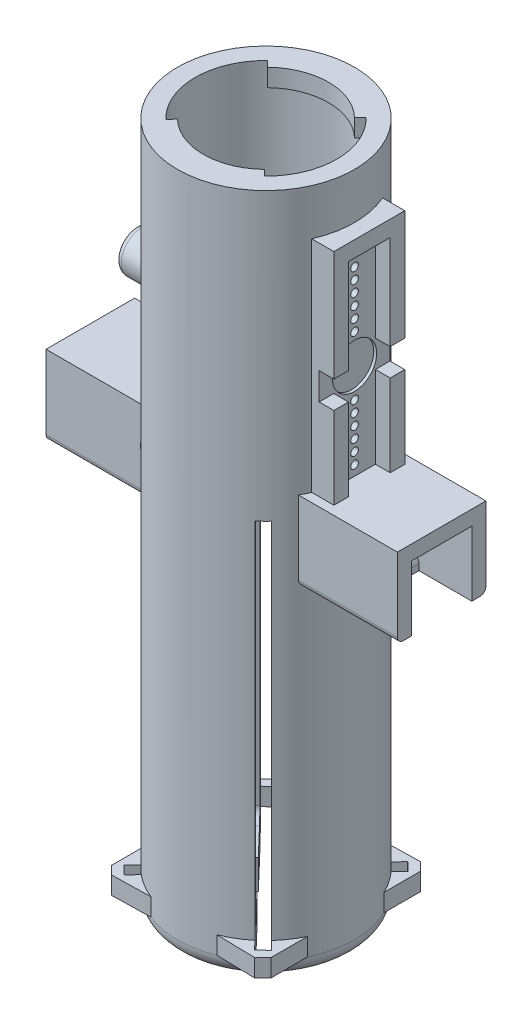
from build123d import *

# Parameters (mm, degrees)
BOSS_EXTRUDE1_START      = -7.5
SKETCH1_R                = 15
BOSS_EXTRUDE1_DEPTH      = 116
CUT_EXTRUDE1_START       = -5
SKETCH2_R                = 12
CUT_EXTRUDE1_DEPTH       = 111
CUT_EXTRUDE2_DEPTH       = 67.5
CUT_EXTRUDE4_START       = -15.000000102
CUT_EXTRUDE4_OUTLINE_R   = 2.85
CUT_EXTRUDE4_DEPTH       = 30.000000204
BOSS_EXTRUDE2_DEPTH      = 16.759618943
SKETCH6_W                = 18.225569428
SKETCH6_H                = 2.4
BOSS_EXTRUDE3_DEPTH      = 11
SKETCH8_W                = 6.702306922
SKETCH8_H                = 2.026544108
BOSS_EXTRUDE4_DEPTH      = 10.2
SKETCH9_W                = 0.702306922
SKETCH9_H                = 8.973455892
BOSS_EXTRUDE5_DEPTH      = 2
MIRROR6_COPY_1_SKETCH_W  = 0.702306922
MIRROR6_COPY_1_SKETCH_H  = 8.973455892
MIRROR6_COPY_1_DEPTH     = 2
BOSS_EXTRUDE13_DEPTH     = 2.628156968
BOSS_EXTRUDE15_START     = -3
BOSS_EXTRUDE15_DEPTH     = 3
SKETCH21_W               = 2.475
SKETCH21_H               = 13.9
BOSS_EXTRUDE16_DEPTH     = 2.5
SKETCH22_R               = 3.75
CUT_EXTRUDE6_DEPTH       = 0.5
BOSS_EXTRUDE17_START     = -22
BOSS_EXTRUDE17_OUTLINE_R = 3.5
BOSS_EXTRUDE17_DEPTH     = 7.414047957
FILLET1_R                = 1
CUT_EXTRUDE7_REACH       = 120.321
CUT_EXTRUDE7_END_RADIUS  = 12
SKETCH23_R               = 0.65
FILLET2_R                = 1
BOSS_EXTRUDE18_START     = -3
BOSS_EXTRUDE18_DEPTH     = 3
FILLET3_R                = 1.75
FILLET5_R                = 3


# Read off the part's stored shape, not the designer's step: Cut-Extrude4, Boss-Extrude17
with BuildPart() as part:
    # Sketch1 → Boss-Extrude1 (new body)
    with BuildSketch(Plane(origin=(0, 0, 0), x_dir=(1, 0, 0), z_dir=(0, 1, 0)).offset(BOSS_EXTRUDE1_START)):
        with Locations(Location((0, 0, 0), (0, 0, 270))):
            Circle(SKETCH1_R)
    extrude(amount=BOSS_EXTRUDE1_DEPTH)

    # Sketch2 → Cut-Extrude1 (cut)
    with BuildSketch(Plane(origin=(0, -7.5, 0), x_dir=(-1, 0, 0), z_dir=(0, -1, 0)).offset(CUT_EXTRUDE1_START)):
        with Locations(Location((0, 0, 0), (0, 0, 90))):
            Circle(SKETCH2_R)
    extrude(amount=-CUT_EXTRUDE1_DEPTH, mode=Mode.SUBTRACT)

    # Sketch3 → Cut-Extrude2 (cut)
    with BuildSketch(Plane.XZ.offset(7.5)):
        with BuildLine():
            Line((1.812764776, -3.339743084), (9.627255771, -11.502866874))
            ThreePointArc((9.627255771, -11.502866874), (10.372695837, -10.835459431), (11.071983695, -10.119840763))
            Line((11.071983695, -10.119840763), (3.2574927, -1.956716973))
            ThreePointArc((3.2574927, -1.956716973), (2.627749612, -2.744983056), (1.812764776, -3.339743084))
        make_face()
        with BuildLine():
            ThreePointArc((-9.627255771, 11.502866874), (-10.372695837, 10.835459431), (-11.071983695, 10.119840763))
            Line((-11.071983695, 10.119840763), (-3.2574927, 1.956716973))
            ThreePointArc((-3.2574927, 1.956716973), (-2.627749612, 2.744983056), (-1.812764776, 3.339743084))
            Line((-1.812764776, 3.339743084), (-9.627255771, 11.502866874))
        make_face()
        with BuildLine():
            ThreePointArc((-11.071983695, -10.119840763), (-10.372695837, -10.835459431), (-9.627255771, -11.502866874))
            Line((-9.627255771, -11.502866874), (-1.812764776, -3.339743084))
            ThreePointArc((-1.812764776, -3.339743084), (-2.627749612, -2.744983056), (-3.2574927, -1.956716973))
            Line((-3.2574927, -1.956716973), (-11.071983695, -10.119840763))
        make_face()
        with BuildLine():
            ThreePointArc((1.812764776, 3.339743084), (2.627749612, 2.744983056), (3.2574927, 1.956716973))
            Line((3.2574927, 1.956716973), (11.071983695, 10.119840763))
            ThreePointArc((11.071983695, 10.119840763), (10.372695837, 10.835459431), (9.627255771, 11.502866874))
            Line((9.627255771, 11.502866874), (1.812764776, 3.339743084))
        make_face()
        with BuildLine():
            Line((0, 1.446104295), (1.3843437, 0))
            Line((1.3843437, 0), (3.2574927, 1.956716973))
            ThreePointArc((3.2574927, 1.956716973), (2.627749612, 2.744983056), (1.812764776, 3.339743084))
            Line((1.812764776, 3.339743084), (0, 1.446104295))
        make_face()
        with BuildLine():
            ThreePointArc((-3.2574927, -1.956716973), (-2.627749612, -2.744983056), (-1.812764776, -3.339743084))
            Line((-1.812764776, -3.339743084), (0, -1.446104295))
            Line((0, -1.446104295), (-1.3843437, 0))
            Line((-1.3843437, 0), (-3.2574927, -1.956716973))
        make_face()
        with BuildLine():
            Line((-3.2574927, 1.956716973), (-1.3843437, 0))
            Line((-1.3843437, 0), (0, 1.446104295))
            Line((0, 1.446104295), (-1.812764776, 3.339743084))
            ThreePointArc((-1.812764776, 3.339743084), (-2.627749612, 2.744983056), (-3.2574927, 1.956716973))
        make_face()
        with BuildLine():
            ThreePointArc((-3.2574927, 1.956716973), (-3.8, 0), (-3.2574927, -1.956716973))
            Line((-3.2574927, -1.956716973), (-1.3843437, 0))
            Line((-1.3843437, 0), (-3.2574927, 1.956716973))
        make_face()
        Polygon((-1.3843437, 0), (0, -1.446104295), (1.3843437, 0), (0, 1.446104295), align=None)
        with BuildLine():
            Line((-1.812764776, 3.339743084), (0, 1.446104295))
            Line((0, 1.446104295), (1.812764776, 3.339743084))
            ThreePointArc((1.812764776, 3.339743084), (0, 3.8), (-1.812764776, 3.339743084))
        make_face()
        with BuildLine():
            Line((3.2574927, 1.956716973), (1.3843437, 0))
            Line((1.3843437, 0), (3.2574927, -1.956716973))
            ThreePointArc((3.2574927, -1.956716973), (3.661862385, -1.015265419), (3.8, 0))
            ThreePointArc((3.8, 0), (3.661862385, 1.015265419), (3.2574927, 1.956716973))
        make_face()
        with BuildLine():
            Line((0, -1.446104295), (-1.812764776, -3.339743084))
            ThreePointArc((-1.812764776, -3.339743084), (0, -3.8), (1.812764776, -3.339743084))
            Line((1.812764776, -3.339743084), (0, -1.446104295))
        make_face()
        with BuildLine():
            Line((1.3843437, 0), (0, -1.446104295))
            Line((0, -1.446104295), (1.812764776, -3.339743084))
            ThreePointArc((1.812764776, -3.339743084), (2.627749612, -2.744983056), (3.2574927, -1.956716973))
            Line((3.2574927, -1.956716973), (1.3843437, 0))
        make_face()
    extrude(amount=-CUT_EXTRUDE2_DEPTH, mode=Mode.SUBTRACT)

    # Cut-Extrude4 outline → Cut-Extrude4 (cut)
    with BuildSketch(Plane.YZ.offset(CUT_EXTRUDE4_START)):
        with Locations((57.25, 0)):
            Circle(CUT_EXTRUDE4_OUTLINE_R)
    extrude(amount=CUT_EXTRUDE4_DEPTH, mode=Mode.SUBTRACT)

    # 3DSketch3 → Boss-Extrude2 (add)
    with BuildSketch(Plane(origin=(29.75, 61, 7.5), x_dir=(0, 0.16439898730535613, -0.986393923832144), z_dir=(-1, 0, 0))):
        Polygon((0, 0), (14.795908857, 2.46598481), (15.206906326, 0), (0.410997468, -2.46598481), align=None)
    boss_extrude2 = extrude(amount=BOSS_EXTRUDE2_DEPTH)

    # Sketch6 → Boss-Extrude3 (add)
    with BuildSketch(Plane.XZ.offset(-61)):
        with Locations((20.637215286, -6.3)):
            Rectangle(SKETCH6_W, SKETCH6_H)
        with Locations((20.637215286, 6.3)):
            Rectangle(SKETCH6_W, SKETCH6_H)
    boss_extrude3 = extrude(amount=BOSS_EXTRUDE3_DEPTH)

    # Sketch8 → Boss-Extrude4 (add)
    with BuildSketch(Plane.XY.offset(-5.1)):
        with Locations((17.457534996, 51.013272054)):
            Rectangle(SKETCH8_W, SKETCH8_H)
    boss_extrude4 = extrude(amount=BOSS_EXTRUDE4_DEPTH)

    # Sketch9 → Boss-Extrude5 (add)
    with BuildSketch(Plane.XY.offset(-5.1)):
        with Locations((14.457534996, 56.513272054)):
            Rectangle(SKETCH9_W, SKETCH9_H)
    boss_extrude5 = extrude(amount=BOSS_EXTRUDE5_DEPTH)

    # Mirror3: Boss-Extrude5 across plane
    add(boss_extrude5.mirror(Plane.XY))

    # Mirror6: Boss-Extrude2, Boss-Extrude3, Boss-Extrude4, Boss-Extrude5 across plane
    add(boss_extrude2.mirror(Plane(origin=(0, 0, 0), x_dir=(0, 0, 1), z_dir=(1, 0, 0))))
    add(boss_extrude3.mirror(Plane(origin=(0, 0, 0), x_dir=(0, 0, 1), z_dir=(1, 0, 0))))
    add(boss_extrude4.mirror(Plane(origin=(0, 0, 0), x_dir=(0, 0, 1), z_dir=(1, 0, 0))))
    add(boss_extrude5.mirror(Plane(origin=(0, 0, 0), x_dir=(0, 0, 1), z_dir=(1, 0, 0))))

    # Mirror6 copy 1 sketch → Mirror6 copy 1 (add)
    with BuildSketch(Plane(origin=(0, 0, 5.1), x_dir=(-1, 0, 0), z_dir=(0, 0, -1))):
        with Locations((14.457534996, 56.513272054)):
            Rectangle(MIRROR6_COPY_1_SKETCH_W, MIRROR6_COPY_1_SKETCH_H)
    extrude(amount=MIRROR6_COPY_1_DEPTH)

    # 3DSketch4 → Boss-Extrude13 (add)
    with BuildSketch(Plane(origin=(15, 63.5, 6), x_dir=(0, 0.9517086177605509, -0.3070027799227583), z_dir=(-1, 0, 0))):
        Polygon((0, 0), (3.684033359, 11.420503413), (39.08759394, 0), (35.403560581, -11.420503413), align=None)
    extrude(amount=BOSS_EXTRUDE13_DEPTH)

    # Sketch20 → Boss-Extrude15 (add)
    with BuildSketch(Plane(origin=(0, 108.5, 0), x_dir=(1, 0, 0), z_dir=(0, 1, 0)).offset(BOSS_EXTRUDE15_START)):
        with BuildLine():
            Line((8.335900446, -8.632077604), (7.363378727, -7.625001884))
            ThreePointArc((7.363378727, -7.625001884), (0, -10.6), (-7.363378727, -7.625001884))
            Line((-7.363378727, -7.625001884), (-8.335900446, -8.632077604))
            ThreePointArc((-8.335900446, -8.632077604), (0, -12), (8.335900446, -8.632077604))
        make_face()
        with BuildLine():
            Line((-8.335900446, 8.632077604), (-7.363378727, 7.625001884))
            ThreePointArc((-7.363378727, 7.625001884), (0, 10.6), (7.363378727, 7.625001884))
            Line((7.363378727, 7.625001884), (8.335900446, 8.632077604))
            ThreePointArc((8.335900446, 8.632077604), (0, 12), (-8.335900446, 8.632077604))
        make_face()
    extrude(amount=BOSS_EXTRUDE15_DEPTH)

    # Sketch21 → Boss-Extrude16 (add)
    with BuildSketch(Plane(origin=(15, 0, 0), x_dir=(0, 0, -1), z_dir=(1, 0, 0))):
        with Locations((-4.7625, 70.45)):
            Rectangle(SKETCH21_W, SKETCH21_H)
        with Locations((4.7625, 70.45)):
            Rectangle(SKETCH21_W, SKETCH21_H)
        Polygon((-6, 100.7), (-6, 82), (-3.525, 82), (-3.525, 98), (3.525, 98), (3.525, 82), (6, 82), (6, 100.7), align=None)
    extrude(amount=BOSS_EXTRUDE16_DEPTH)

    # Sketch22 → Cut-Extrude6 (cut)
    with BuildSketch(Plane(origin=(15, 0, 0), x_dir=(0, 0, -1), z_dir=(1, 0, 0))):
        with Locations((0, 79.7)):
            Circle(SKETCH22_R)
    extrude(amount=-CUT_EXTRUDE6_DEPTH, mode=Mode.SUBTRACT)

    # Boss-Extrude17 outline → Boss-Extrude17 (add)
    with BuildSketch(Plane.YZ.offset(BOSS_EXTRUDE17_START)):
        with Locations((78.5, 0)):
            Circle(BOSS_EXTRUDE17_OUTLINE_R)
    extrude(amount=BOSS_EXTRUDE17_DEPTH)

    # Fillet1
    fillet1_edges = [part.edges().sort_by_distance(p)[0] for p in [
        (-22, 75, 0),
    ]]
    fillet(fillet1_edges, radius=FILLET1_R)

    # Cut-Extrude7: up to this cylinder (the profile starts outside it)
    cut_extrude7_end = Plane(origin=(0, 79.7, 0), z_dir=(0, -1, 0)) * Cylinder(CUT_EXTRUDE7_END_RADIUS, 294.642, mode=Mode.PRIVATE)
    # Sketch23 → Cut-Extrude7 (cut, up to the surface)
    with BuildSketch(Plane(origin=(15, 0, 0), x_dir=(0, 0, -1), z_dir=(1, 0, 0)), mode=Mode.PRIVATE) as cut_extrude7_sk1:
        with Locations((0, 94.2)):
            Circle(SKETCH23_R)
    cut_extrude7_tool1 = extrude(cut_extrude7_sk1.sketch, amount=-CUT_EXTRUDE7_REACH, mode=Mode.PRIVATE) - cut_extrude7_end
    add(cut_extrude7_tool1.solids().sort_by_distance((15, 94.2, 0))[0], mode=Mode.SUBTRACT)
    # Sketch23 → Cut-Extrude7 (cut, up to the surface)
    with BuildSketch(Plane(origin=(15, 0, 0), x_dir=(0, 0, -1), z_dir=(1, 0, 0)), mode=Mode.PRIVATE) as cut_extrude7_sk2:
        with Locations((0, 92.3)):
            Circle(SKETCH23_R)
    cut_extrude7_tool2 = extrude(cut_extrude7_sk2.sketch, amount=-CUT_EXTRUDE7_REACH, mode=Mode.PRIVATE) - cut_extrude7_end
    add(cut_extrude7_tool2.solids().sort_by_distance((15, 92.3, 0))[0], mode=Mode.SUBTRACT)
    # Sketch23 → Cut-Extrude7 (cut, up to the surface)
    with BuildSketch(Plane(origin=(15, 0, 0), x_dir=(0, 0, -1), z_dir=(1, 0, 0)), mode=Mode.PRIVATE) as cut_extrude7_sk3:
        with Locations((0, 90.4)):
            Circle(SKETCH23_R)
    cut_extrude7_tool3 = extrude(cut_extrude7_sk3.sketch, amount=-CUT_EXTRUDE7_REACH, mode=Mode.PRIVATE) - cut_extrude7_end
    add(cut_extrude7_tool3.solids().sort_by_distance((15, 90.4, 0))[0], mode=Mode.SUBTRACT)
    # Sketch23 → Cut-Extrude7 (cut, up to the surface)
    with BuildSketch(Plane(origin=(15, 0, 0), x_dir=(0, 0, -1), z_dir=(1, 0, 0)), mode=Mode.PRIVATE) as cut_extrude7_sk4:
        with Locations((0, 88.5)):
            Circle(SKETCH23_R)
    cut_extrude7_tool4 = extrude(cut_extrude7_sk4.sketch, amount=-CUT_EXTRUDE7_REACH, mode=Mode.PRIVATE) - cut_extrude7_end
    add(cut_extrude7_tool4.solids().sort_by_distance((15, 88.5, 0))[0], mode=Mode.SUBTRACT)
    # Sketch23 → Cut-Extrude7 (cut, up to the surface)
    with BuildSketch(Plane(origin=(15, 0, 0), x_dir=(0, 0, -1), z_dir=(1, 0, 0)), mode=Mode.PRIVATE) as cut_extrude7_sk5:
        with Locations((0, 86.6)):
            Circle(SKETCH23_R)
    cut_extrude7_tool5 = extrude(cut_extrude7_sk5.sketch, amount=-CUT_EXTRUDE7_REACH, mode=Mode.PRIVATE) - cut_extrude7_end
    add(cut_extrude7_tool5.solids().sort_by_distance((15, 86.6, 0))[0], mode=Mode.SUBTRACT)
    # Sketch23 → Cut-Extrude7 (cut, up to the surface)
    with BuildSketch(Plane(origin=(15, 0, 0), x_dir=(0, 0, -1), z_dir=(1, 0, 0)), mode=Mode.PRIVATE) as cut_extrude7_sk6:
        with Locations((0, 84.7)):
            Circle(SKETCH23_R)
    cut_extrude7_tool6 = extrude(cut_extrude7_sk6.sketch, amount=-CUT_EXTRUDE7_REACH, mode=Mode.PRIVATE) - cut_extrude7_end
    add(cut_extrude7_tool6.solids().sort_by_distance((15, 84.7, 0))[0], mode=Mode.SUBTRACT)
    # Sketch23 → Cut-Extrude7 (cut, up to the surface)
    with BuildSketch(Plane(origin=(15, 0, 0), x_dir=(0, 0, -1), z_dir=(1, 0, 0)), mode=Mode.PRIVATE) as cut_extrude7_sk7:
        with Locations((0, 74.7)):
            Circle(SKETCH23_R)
    cut_extrude7_tool7 = extrude(cut_extrude7_sk7.sketch, amount=-CUT_EXTRUDE7_REACH, mode=Mode.PRIVATE) - cut_extrude7_end
    add(cut_extrude7_tool7.solids().sort_by_distance((15, 74.7, 0))[0], mode=Mode.SUBTRACT)
    # Sketch23 → Cut-Extrude7 (cut, up to the surface)
    with BuildSketch(Plane(origin=(15, 0, 0), x_dir=(0, 0, -1), z_dir=(1, 0, 0)), mode=Mode.PRIVATE) as cut_extrude7_sk8:
        with Locations((0, 72.8)):
            Circle(SKETCH23_R)
    cut_extrude7_tool8 = extrude(cut_extrude7_sk8.sketch, amount=-CUT_EXTRUDE7_REACH, mode=Mode.PRIVATE) - cut_extrude7_end
    add(cut_extrude7_tool8.solids().sort_by_distance((15, 72.8, 0))[0], mode=Mode.SUBTRACT)
    # Sketch23 → Cut-Extrude7 (cut, up to the surface)
    with BuildSketch(Plane(origin=(15, 0, 0), x_dir=(0, 0, -1), z_dir=(1, 0, 0)), mode=Mode.PRIVATE) as cut_extrude7_sk9:
        with Locations((0, 70.9)):
            Circle(SKETCH23_R)
    cut_extrude7_tool9 = extrude(cut_extrude7_sk9.sketch, amount=-CUT_EXTRUDE7_REACH, mode=Mode.PRIVATE) - cut_extrude7_end
    add(cut_extrude7_tool9.solids().sort_by_distance((15, 70.9, 0))[0], mode=Mode.SUBTRACT)
    # Sketch23 → Cut-Extrude7 (cut, up to the surface)
    with BuildSketch(Plane(origin=(15, 0, 0), x_dir=(0, 0, -1), z_dir=(1, 0, 0)), mode=Mode.PRIVATE) as cut_extrude7_sk10:
        with Locations((0, 69)):
            Circle(SKETCH23_R)
    cut_extrude7_tool10 = extrude(cut_extrude7_sk10.sketch, amount=-CUT_EXTRUDE7_REACH, mode=Mode.PRIVATE) - cut_extrude7_end
    add(cut_extrude7_tool10.solids().sort_by_distance((15, 69, 0))[0], mode=Mode.SUBTRACT)
    # Sketch23 → Cut-Extrude7 (cut, up to the surface)
    with BuildSketch(Plane(origin=(15, 0, 0), x_dir=(0, 0, -1), z_dir=(1, 0, 0)), mode=Mode.PRIVATE) as cut_extrude7_sk11:
        with Locations((0, 67.1)):
            Circle(SKETCH23_R)
    cut_extrude7_tool11 = extrude(cut_extrude7_sk11.sketch, amount=-CUT_EXTRUDE7_REACH, mode=Mode.PRIVATE) - cut_extrude7_end
    add(cut_extrude7_tool11.solids().sort_by_distance((15, 67.1, 0))[0], mode=Mode.SUBTRACT)
    # Sketch23 → Cut-Extrude7 (cut, up to the surface)
    with BuildSketch(Plane(origin=(15, 0, 0), x_dir=(0, 0, -1), z_dir=(1, 0, 0)), mode=Mode.PRIVATE) as cut_extrude7_sk12:
        with Locations((0, 65.2)):
            Circle(SKETCH23_R)
    cut_extrude7_tool12 = extrude(cut_extrude7_sk12.sketch, amount=-CUT_EXTRUDE7_REACH, mode=Mode.PRIVATE) - cut_extrude7_end
    add(cut_extrude7_tool12.solids().sort_by_distance((15, 65.2, 0))[0], mode=Mode.SUBTRACT)

    # Fillet2
    fillet2_edges = [part.edges().sort_by_distance(p)[0] for p in [
        (21.370190528, 50, -7.5),
        (21.370190528, 50, 7.5),
        (20.808688457, 52.026544108, 0),
        (-21.370190528, 50, -7.5),
        (-21.370190528, 50, 7.5),
        (-20.808688457, 52.026544108, 0),
    ]]
    fillet(fillet2_edges, radius=FILLET2_R)

    # Sketch25 → Boss-Extrude18 (add)
    with BuildSketch(Plane.XZ.offset(7.5).offset(BOSS_EXTRUDE18_START)):
        with BuildLine():
            ThreePointArc((-13.515355494, 6.506547923), (-12.425710579, 8.402482765), (-11.071983695, 10.119840763))
            Line((-11.071983695, 10.119840763), (-12.47808591, 11.588674299))
            Line((-12.47808591, 11.588674299), (-13.515355494, 12.672220242))
            Line((-13.515355494, 12.672220242), (-13.515355494, 6.506547923))
        make_face()
        Polygon((-11.033357986, 12.971700411), (-12.07062757, 14.055246354), (-13.515355494, 12.672220242), (-12.47808591, 11.588674299), align=None)
        with BuildLine():
            Line((-11.033357986, 12.971700411), (-9.627255771, 11.502866874))
            ThreePointArc((-9.627255771, 11.502866874), (-7.710125517, 12.86677755), (-5.603304219, 13.914128856))
            Line((-5.603304219, 13.914128856), (-12.07062757, 14.055246354))
            Line((-12.07062757, 14.055246354), (-11.033357986, 12.971700411))
        make_face()
        with BuildLine():
            ThreePointArc((5.603304219, 13.914128856), (7.710125517, 12.86677755), (9.627255771, 11.502866874))
            Line((9.627255771, 11.502866874), (11.033357986, 12.971700411))
            Line((11.033357986, 12.971700411), (12.07062757, 14.055246354))
            Line((12.07062757, 14.055246354), (5.603304219, 13.914128856))
        make_face()
        Polygon((12.07062757, 14.055246354), (13.515355494, 12.672220242), (12.47808591, 11.588674299), (11.033357986, 12.971700411), align=None)
        with BuildLine():
            Line((12.47808591, 11.588674299), (11.071983695, 10.119840763))
            ThreePointArc((11.071983695, 10.119840763), (12.425710579, 8.402482765), (13.515355494, 6.506547923))
            Line((13.515355494, 6.506547923), (13.515355494, 12.672220242))
            Line((13.515355494, 12.672220242), (12.47808591, 11.588674299))
        make_face()
        with BuildLine():
            ThreePointArc((13.515355494, -6.506547923), (12.425710579, -8.402482765), (11.071983695, -10.119840763))
            Line((11.071983695, -10.119840763), (12.47808591, -11.588674299))
            Line((12.47808591, -11.588674299), (13.515355494, -12.672220242))
            Line((13.515355494, -12.672220242), (13.515355494, -6.506547923))
        make_face()
        Polygon((12.47808591, -11.588674299), (11.033357986, -12.971700411), (12.07062757, -14.055246354), (13.515355494, -12.672220242), align=None)
        with BuildLine():
            Line((11.033357986, -12.971700411), (9.627255771, -11.502866874))
            ThreePointArc((9.627255771, -11.502866874), (7.710125517, -12.86677755), (5.603304219, -13.914128856))
            Line((5.603304219, -13.914128856), (12.07062757, -14.055246354))
            Line((12.07062757, -14.055246354), (11.033357986, -12.971700411))
        make_face()
        with BuildLine():
            Line((-12.47808591, -11.588674299), (-11.071983695, -10.119840763))
            ThreePointArc((-11.071983695, -10.119840763), (-12.425710579, -8.402482765), (-13.515355494, -6.506547923))
            Line((-13.515355494, -6.506547923), (-13.515355494, -12.672220242))
            Line((-13.515355494, -12.672220242), (-12.47808591, -11.588674299))
        make_face()
        Polygon((-12.07062757, -14.055246354), (-13.515355494, -12.672220242), (-12.47808591, -11.588674299), (-11.033357986, -12.971700411), align=None)
        with BuildLine():
            ThreePointArc((-5.603304219, -13.914128856), (-7.710125517, -12.86677755), (-9.627255771, -11.502866874))
            Line((-9.627255771, -11.502866874), (-11.033357986, -12.971700411))
            Line((-11.033357986, -12.971700411), (-12.07062757, -14.055246354))
            Line((-12.07062757, -14.055246354), (-5.603304219, -13.914128856))
        make_face()
    extrude(amount=-BOSS_EXTRUDE18_DEPTH)

    # Fillet3
    fillet3_edges = [part.edges().sort_by_distance(p)[0] for p in [
        (0, -2.5, 12),
        (-12, -2.5, 0),
        (4.002701838, -2.5, -11.312752892),
        (12, -2.5, 0),
    ]]
    fillet(fillet3_edges, radius=FILLET3_R)

    # Fillet5
    fillet5_edges = [part.edges().sort_by_distance(p)[0] for p in [
        (-5.121376616, -7.5, 14.098634741),
        (15, -7.5, 0),
        (0, -7.5, -15),
        (-15, -7.5, 0),
    ]]
    fillet(fillet5_edges, radius=FILLET5_R - 0.0001)  # a hair under: the kernel refuses the full size


solid = part.part
